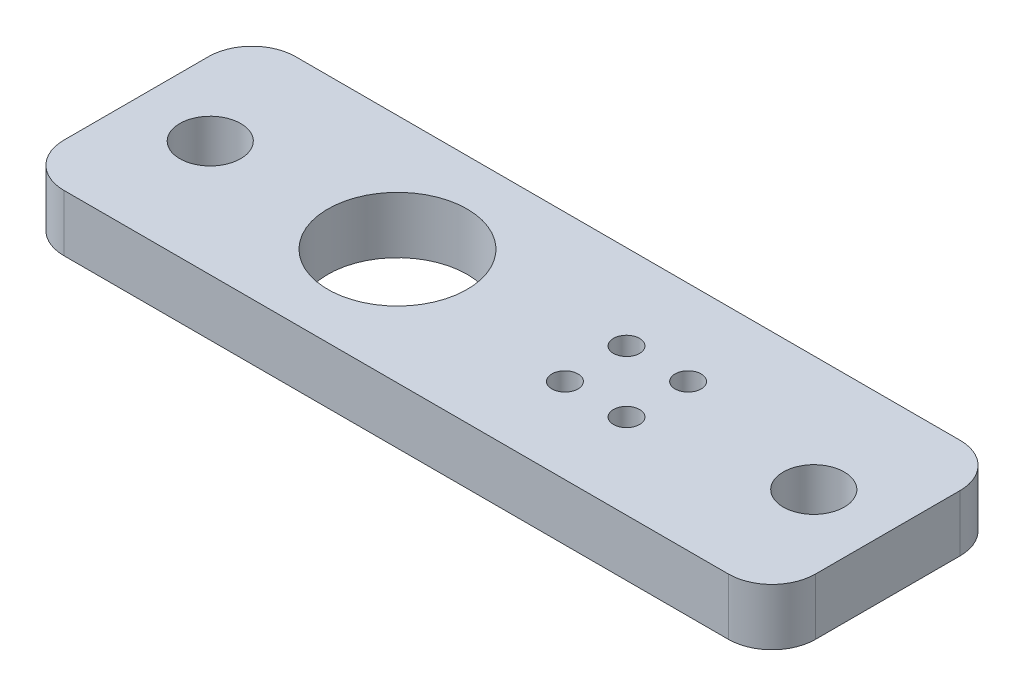
from build123d import *

# Parameters (mm, degrees)
SKETCH1_W           = 86.3
SKETCH1_H           = 26.6
SKETCH1_R           = 3.5
SKETCH1_R_2         = 8
BOSS_EXTRUDE1_DEPTH = 6.5
SKETCH2_R           = 8.3
CUT_EXTRUDE1_DEPTH  = 2
FILLET1_R           = 5
CUT_EXTRUDE2_REACH  = 60.024
SKETCH3_R           = 1.5
CIRPATTERN1_COUNT   = 4


with BuildPart() as part:
    # Sketch1 → Boss-Extrude1 (new body)
    with BuildSketch(Plane(origin=(0, 0, 0), x_dir=(1, 0, 0), z_dir=(0, 1, 0))):
        with Locations((-13.15, 0)):
            Rectangle(SKETCH1_W, SKETCH1_H)
        with Locations((-47.8, 0)):
            Circle(SKETCH1_R, mode=Mode.SUBTRACT)
        with Locations((21.5, 0)):
            Circle(SKETCH1_R, mode=Mode.SUBTRACT)
        with Locations((-26.3, 0)):
            Circle(SKETCH1_R_2, mode=Mode.SUBTRACT)
    extrude(amount=BOSS_EXTRUDE1_DEPTH)

    # Sketch2 → Cut-Extrude1 (cut)
    with BuildSketch(Plane.XZ):
        Circle(SKETCH2_R)
    extrude(amount=-CUT_EXTRUDE1_DEPTH, mode=Mode.SUBTRACT)

    # Fillet1
    fillet1_edges = [part.edges().sort_by_distance(p)[0] for p in [
        (-56.3, 3.25, -13.3),
        (30, 3.25, -13.3),
        (30, 3.25, 13.3),
        (-56.3, 3.25, 13.3),
    ]]
    fillet(fillet1_edges, radius=FILLET1_R)

    # Sketch3 → Cut-Extrude2 (cut, up to next)
    with BuildSketch(Plane.XZ.offset(-2), mode=Mode.PRIVATE) as cut_extrude2_sk1:
        with Locations((3.535533906, 3.535533906)):
            Circle(SKETCH3_R)
    cut_extrude2_tool1 = extrude(cut_extrude2_sk1.sketch, amount=-CUT_EXTRUDE2_REACH, mode=Mode.PRIVATE) & part.part
    cut_extrude2 = cut_extrude2_tool1.solids().sort_by_distance((3.535534, 2, 3.535534))[0]
    add(cut_extrude2, mode=Mode.SUBTRACT)

    # CirPattern1: Cut-Extrude2 ×4 about axis
    cirpattern1_axis = Axis((0, 2, 0), (0, -1, 0))
    for i in range(1, CIRPATTERN1_COUNT):
        add(cut_extrude2.rotate(cirpattern1_axis, i * 360 / CIRPATTERN1_COUNT), mode=Mode.SUBTRACT)


solid = part.part
